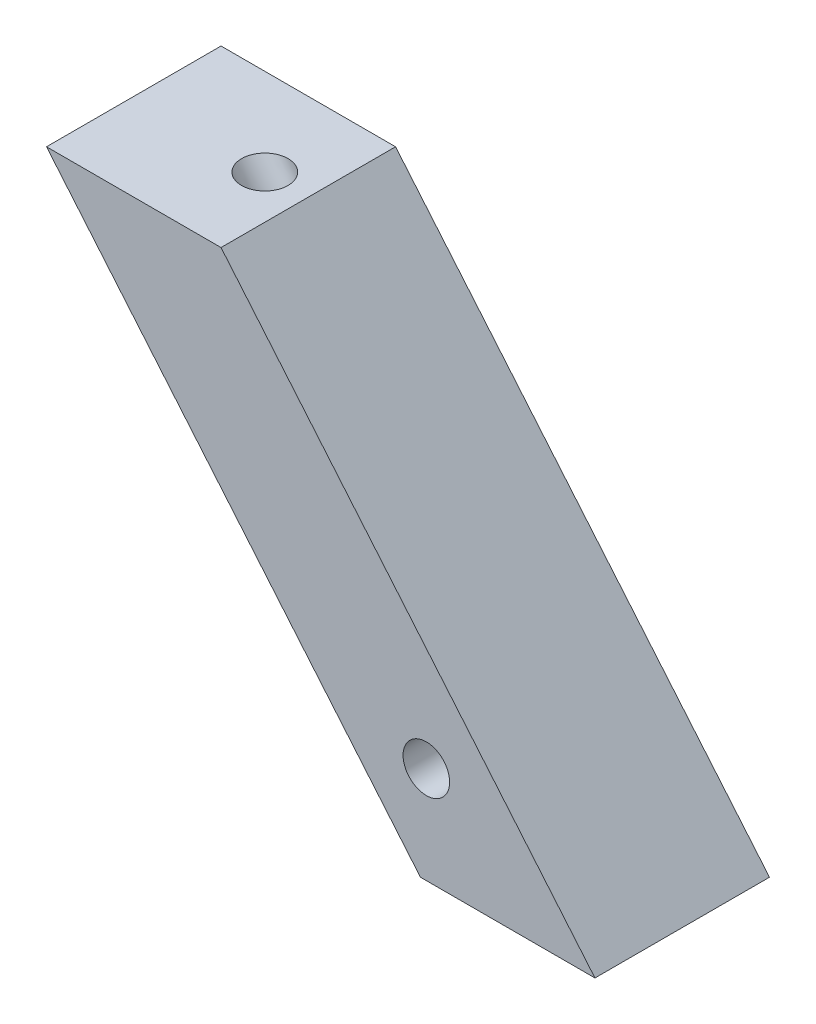
from build123d import *

# Parameters (mm, degrees)
SKETCH_1_W             = 90
SKETCH_1_H             = 90
HOLE_WIZARD_M4_1_D     = 3.3
HOLE_WIZARD_M4_1_DEPTH = 16
HOLE_WIZARD_M4_1_TIP   = 0.991420021
SKETCH_5_R             = 12
CUT_EXTRUDE_1_REACH    = 364.795
SKETCH_9_R             = 12


with BuildPart() as part:
    # 扫描1: sweep along a path in 草图2
    with BuildLine(Plane.XY) as sweep_1_path:
        Line((-28.069306931, 0), (-220.905589837, 229.813332936))
    # 草图1 → 扫描1 (sweep)
    with BuildSketch(Plane(origin=(0, 0, 0), x_dir=(1, 0, 0), z_dir=(0, 1, 0))):
        with Locations((-28.069306931, -27.846534653)):
            Rectangle(SKETCH_1_W, SKETCH_1_H)
    sweep(path=sweep_1_path.line)

    # M4 螺纹孔1
    with Locations(Plane(origin=(-51.069306931, 0, 50.846534653), x_dir=(0, 0, -1), z_dir=(0, -1, 0))):
        with Locations((0, 0), (0, 46), (46, 46), (46, 0)):
            Hole(HOLE_WIZARD_M4_1_D / 2, depth=HOLE_WIZARD_M4_1_DEPTH)
            with Locations((0, 0, -(HOLE_WIZARD_M4_1_DEPTH + HOLE_WIZARD_M4_1_TIP / 2))):  # 118° drill point
                Cone(0, HOLE_WIZARD_M4_1_D / 2, HOLE_WIZARD_M4_1_TIP, mode=Mode.SUBTRACT)

    # 切除-扫描2: sweep along a path in 草图8
    with BuildLine(Plane.XY.offset(72.846534653)) as sweep_2_path:
        Line((-28.069306931, 0), (-198.315967451, 229.813332936))
    # 草图5 → 切除-扫描2 (sweep, cut)
    with BuildSketch(Plane.XZ):
        with Locations((-28.069306931, 27.846534653)):
            Circle(SKETCH_5_R)
    sweep(path=sweep_2_path.line, mode=Mode.SUBTRACT)

    # 草图9 → 切除-拉伸1 (cut, up to next)
    with BuildSketch(Plane(origin=(0, 0, -17.153465347), x_dir=(-1, 0, 0), z_dir=(0, 0, -1)), mode=Mode.PRIVATE) as cut_extrude_1_sk1:
        with Locations((70.02428849, 50)):
            Circle(SKETCH_9_R)
    cut_extrude_1_tool1 = extrude(cut_extrude_1_sk1.sketch, amount=-CUT_EXTRUDE_1_REACH, mode=Mode.PRIVATE) & part.part
    add(cut_extrude_1_tool1.solids().sort_by_distance((-70.024288, 50, -17.153465))[0], mode=Mode.SUBTRACT)


solid = part.part
